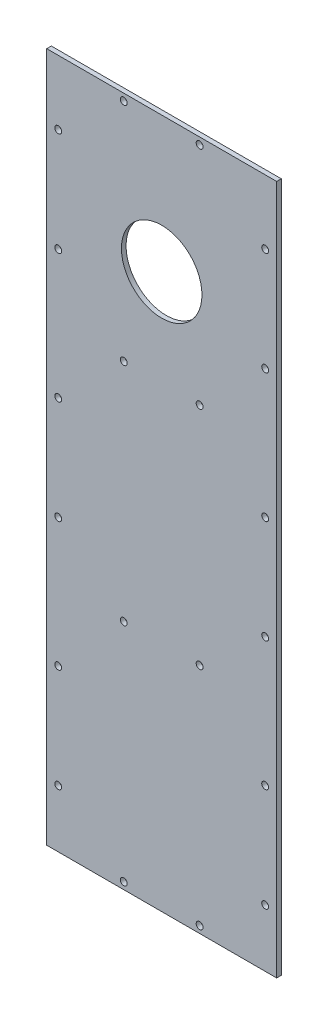
from build123d import *

# Parameters (mm, degrees)
SKETCH1_W           = 100
SKETCH1_H           = 300
BOSS_EXTRUDE1_DEPTH = 2
SKETCH2_R           = 1.5
CUT_EXTRUDE1_DEPTH  = 10
SKETCH3_R           = 17.5
CUT_EXTRUDE2_DEPTH  = 10


with BuildPart() as part:
    # Sketch1 → Boss-Extrude1 (new body)
    with BuildSketch(Plane.XY):
        Rectangle(SKETCH1_W, SKETCH1_H)
    extrude(amount=BOSS_EXTRUDE1_DEPTH)

    # Sketch2 → Cut-Extrude1 (cut)
    with BuildSketch(Plane.XY.offset(2)):
        with Locations((-45, 122)):
            Circle(SKETCH2_R)
        with Locations((-45, 77)):
            Circle(SKETCH2_R)
        with Locations((45, 122)):
            Circle(SKETCH2_R)
        with Locations((45, 77)):
            Circle(SKETCH2_R)
        with Locations((-45, 21)):
            Circle(SKETCH2_R)
        with Locations((-45, -24)):
            Circle(SKETCH2_R)
        with Locations((45, 21)):
            Circle(SKETCH2_R)
        with Locations((45, -24)):
            Circle(SKETCH2_R)
        with Locations((-45, -80)):
            Circle(SKETCH2_R)
        with Locations((-45, -125)):
            Circle(SKETCH2_R)
        with Locations((45, -80)):
            Circle(SKETCH2_R)
        with Locations((45, -125)):
            Circle(SKETCH2_R)
        with Locations((16.5, -147)):
            Circle(SKETCH2_R)
        with Locations((-16.5, -147)):
            Circle(SKETCH2_R)
        with Locations((-16.5, -49)):
            Circle(SKETCH2_R)
        with Locations((16.5, -49)):
            Circle(SKETCH2_R)
        with Locations((-16.5, 49)):
            Circle(SKETCH2_R)
        with Locations((16.5, 49)):
            Circle(SKETCH2_R)
        with Locations((-16.5, 147)):
            Circle(SKETCH2_R)
        with Locations((16.5, 147)):
            Circle(SKETCH2_R)
    extrude(amount=-CUT_EXTRUDE1_DEPTH, mode=Mode.SUBTRACT)

    # Sketch3 → Cut-Extrude2 (cut)
    with BuildSketch(Plane(origin=(0, 0, 0), x_dir=(-1, 0, 0), z_dir=(0, 0, -1))):
        with Locations((0, 91)):
            Circle(SKETCH3_R)
    extrude(amount=-CUT_EXTRUDE2_DEPTH, mode=Mode.SUBTRACT)


solid = part.part
